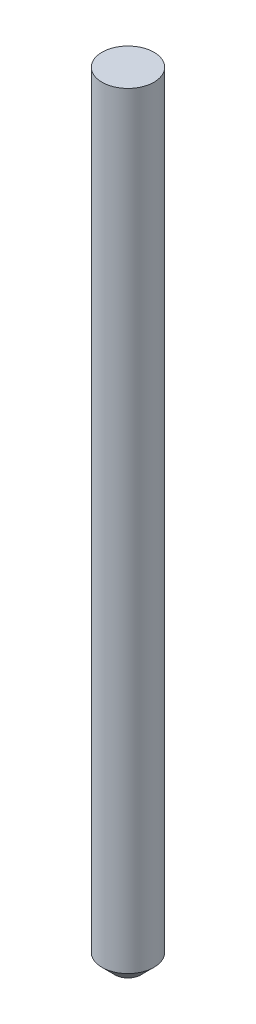
from build123d import *

# Parameters (mm, degrees)
SKETCH1_R           = 4
BOSS_EXTRUDE1_DEPTH = 120
CHAMFER1_SIZE       = 2


with BuildPart() as part:
    # Sketch1 → Boss-Extrude1 (new body)
    with BuildSketch(Plane(origin=(0, 0, 0), x_dir=(1, 0, 0), z_dir=(0, 1, 0))):
        Circle(SKETCH1_R)
    extrude(amount=BOSS_EXTRUDE1_DEPTH)

    # Chamfer1
    chamfer1_edges = [part.edges().sort_by_distance(p)[0] for p in [
        (-4, 0, 0),
    ]]
    chamfer(chamfer1_edges, length=CHAMFER1_SIZE)


solid = part.part
